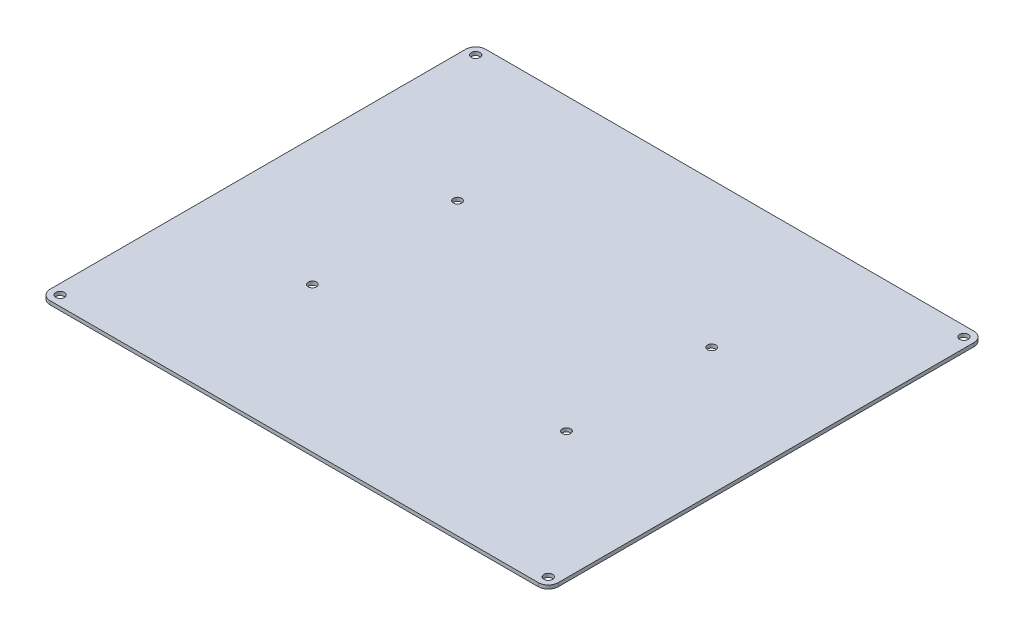
from build123d import *

# Parameters (mm, degrees)
SKETCH1_W           = 140
SKETCH1_H           = 120
SKETCH1_R           = 1.2
SKETCH1_R_2         = 1.15
BOSS_EXTRUDE1_DEPTH = 1
FILLET1_R           = 2.75


with BuildPart() as part:
    # Sketch1 → Boss-Extrude1 (new body)
    with BuildSketch(Plane(origin=(0, 0, 0), x_dir=(1, 0, 0), z_dir=(0, 1, 0))):
        with Locations((70, -60)):
            Rectangle(SKETCH1_W, SKETCH1_H)
        with Locations((2.75, -2.75)):
            Circle(SKETCH1_R, mode=Mode.SUBTRACT)
        with Locations((137.25, -2.75)):
            Circle(SKETCH1_R, mode=Mode.SUBTRACT)
        with Locations((137.25, -117.25)):
            Circle(SKETCH1_R, mode=Mode.SUBTRACT)
        with Locations((2.75, -117.25)):
            Circle(SKETCH1_R, mode=Mode.SUBTRACT)
        with Locations((35, -40)):
            Circle(SKETCH1_R_2, mode=Mode.SUBTRACT)
        with Locations((105, -40)):
            Circle(SKETCH1_R_2, mode=Mode.SUBTRACT)
        with Locations((35, -80)):
            Circle(SKETCH1_R_2, mode=Mode.SUBTRACT)
        with Locations((105, -80)):
            Circle(SKETCH1_R_2, mode=Mode.SUBTRACT)
    extrude(amount=BOSS_EXTRUDE1_DEPTH)

    # Fillet1
    fillet1_edges = [part.edges().sort_by_distance(p)[0] for p in [
        (0, 0.5, 0),
        (140, 0.5, 0),
        (140, 0.5, 120),
        (0, 0.5, 120),
    ]]
    fillet(fillet1_edges, radius=FILLET1_R)


solid = part.part
